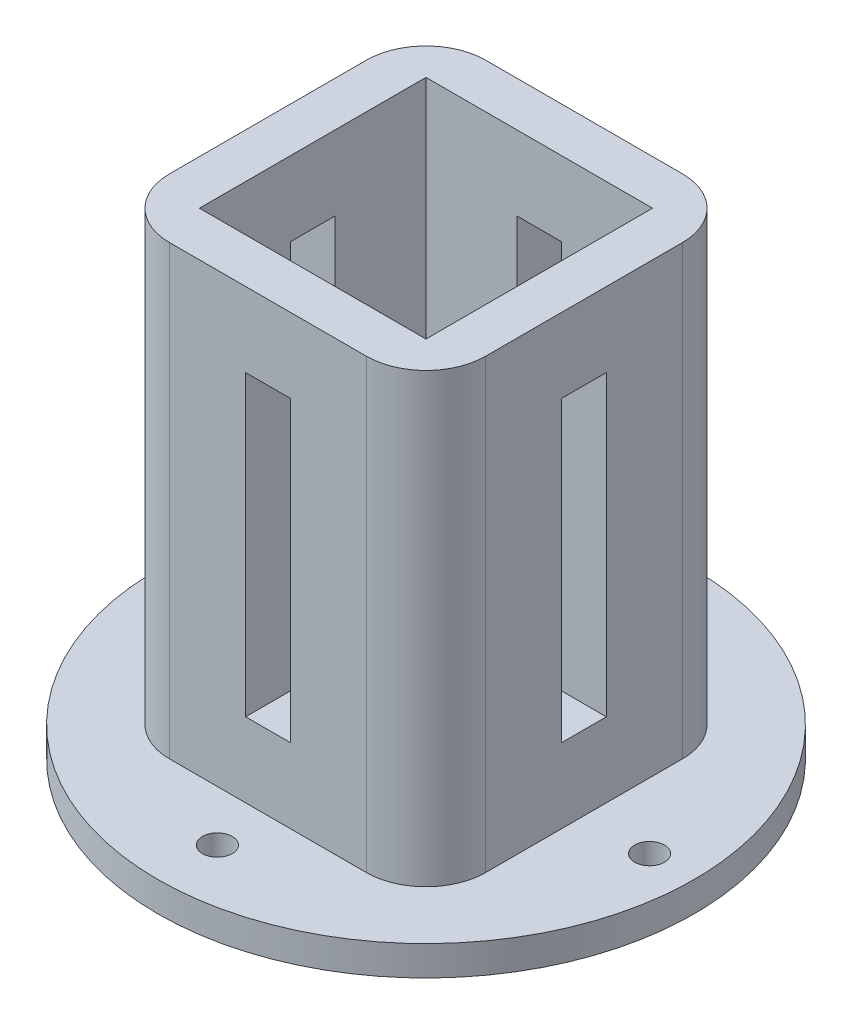
from build123d import *

# Parameters (mm, degrees)
SKETCH1_W           = 21.2
SKETCH1_H           = 21.2
SKETCH1_W_2         = 15.2
SKETCH1_H_2         = 15.2
BOSS_EXTRUDE1_DEPTH = 30
FILLET1_R           = 4
SKETCH3_R           = 18
BOSS_EXTRUDE2_DEPTH = 2
CUT_EXTRUDE2_REACH  = 41.345
SKETCH4_R           = 1.5
SKETCH5_W           = 3
SKETCH5_H           = 20
CUT_EXTRUDE3_DEPTH  = 46.188051518
SKETCH6_W           = 3
SKETCH6_H           = 20
CUT_EXTRUDE4_DEPTH  = 46.188051518
SKETCH7_R           = 1
CUT_EXTRUDE5_DEPTH  = 2
FILLET4_SIZE        = 1
FILLET5_R           = 0.2


with BuildPart() as part:
    # Sketch1 → Boss-Extrude1 (new body)
    with BuildSketch(Plane(origin=(0, 0, 0), x_dir=(1, 0, 0), z_dir=(0, 1, 0))):
        Rectangle(SKETCH1_W, SKETCH1_H)
        Rectangle(SKETCH1_W_2, SKETCH1_H_2, mode=Mode.SUBTRACT)
    extrude(amount=BOSS_EXTRUDE1_DEPTH)

    # Fillet1
    fillet1_edges = [part.edges().sort_by_distance(p)[0] for p in [
        (10.6, 15, 10.6),
        (-10.6, 15, 10.6),
        (-10.6, 15, -10.6),
        (10.6, 15, -10.6),
    ]]
    fillet(fillet1_edges, radius=FILLET1_R)

    # Sketch3 → Boss-Extrude2 (add)
    with BuildSketch(Plane.XZ):
        with Locations(Location((0, 0, 0), (0, 0, 270))):
            Circle(SKETCH3_R)
    extrude(amount=BOSS_EXTRUDE2_DEPTH)

    # Sketch4 → Cut-Extrude2 (cut, up to next)
    with BuildSketch(Plane(origin=(0, 0, 0), x_dir=(1, 0, 0), z_dir=(0, 1, 0)), mode=Mode.PRIVATE) as cut_extrude2_sk1:
        with Locations(Location((0, 0, 0), (0, 0, 270))):
            Circle(SKETCH4_R)
    cut_extrude2_tool1 = extrude(cut_extrude2_sk1.sketch, amount=-CUT_EXTRUDE2_REACH, mode=Mode.PRIVATE) & part.part
    add(cut_extrude2_tool1.solids().sort_by_distance((0, 0, 0))[0], mode=Mode.SUBTRACT)

    # Sketch5 → Cut-Extrude3 (cut, through all)
    with BuildSketch(Plane(origin=(0, 0, -10.6), x_dir=(-1, 0, 0), z_dir=(0, 0, -1))):
        with Locations((0, 15)):
            Rectangle(SKETCH5_W, SKETCH5_H)
    extrude(amount=-CUT_EXTRUDE3_DEPTH, mode=Mode.SUBTRACT)

    # Sketch6 → Cut-Extrude4 (cut, through all)
    with BuildSketch(Plane(origin=(10.6, 0, 0), x_dir=(0, 0, -1), z_dir=(1, 0, 0))):
        with Locations((0, 15)):
            Rectangle(SKETCH6_W, SKETCH6_H)
    extrude(amount=-CUT_EXTRUDE4_DEPTH, mode=Mode.SUBTRACT)

    # Sketch7 → Cut-Extrude5 (cut)
    with BuildSketch(Plane(origin=(0, -2, 0), x_dir=(-1, 0, 0), z_dir=(0, -1, 0))):
        with Locations(Location((14, 0, 0), (0, 0, 90))):
            Circle(SKETCH7_R)
        with Locations(Location((-15, 0, 0), (0, 0, 270))):
            Circle(SKETCH7_R)
        with Locations(Location((0, 14, 0), (0, 0, 90))):
            Circle(SKETCH7_R)
        with Locations(Location((0, -14, 0), (0, 0, 270))):
            Circle(SKETCH7_R)
    extrude(amount=-CUT_EXTRUDE5_DEPTH, mode=Mode.SUBTRACT)

    # Fillet4
    # a fillet whose section is not a circle: 1 mm, written as the material it takes off along each edge
    with BuildSketch(Plane(origin=(0, 0, 0), x_dir=(0, 0, 1), z_dir=(-1, 0, 0))) as fillet4_piece_1:
        with BuildLine():
            Bezier((1.5, -FILLET4_SIZE), (1.5, 0), (1.5 + FILLET4_SIZE, 0), weights=[1, 0.070710678, 1])
            Line((1.5 + FILLET4_SIZE, 0), (1.5, 0))
            Line((1.5, 0), (1.5, -FILLET4_SIZE))
        make_face()
    revolve(axis=Axis((0, 0, 0), (0, 1, 0)), mode=Mode.SUBTRACT)

    # Fillet5
    fillet5_edges = [part.edges().sort_by_distance(p)[0] for p in [
        (0, -2, -1.5),
    ]]
    fillet(fillet5_edges, radius=FILLET5_R)


solid = part.part
